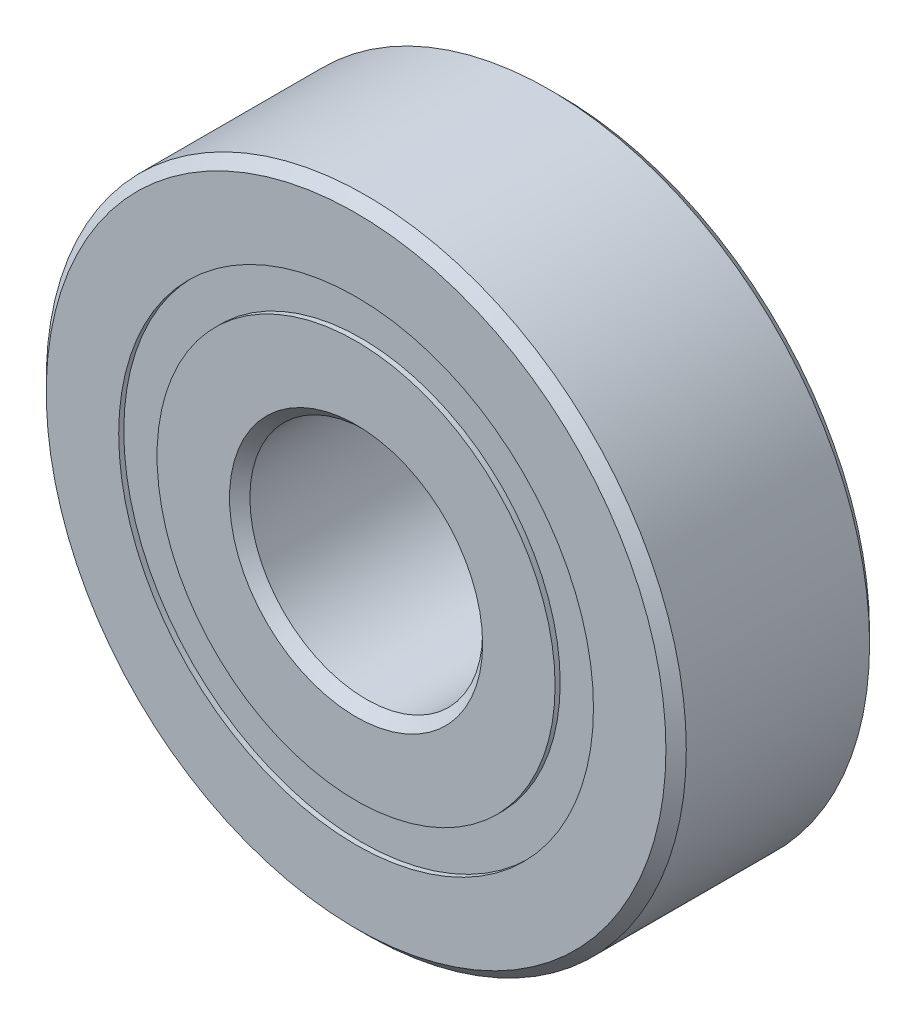
from build123d import *

# Parameters (mm, degrees)
SKETCH6_W = 1.635478413
SKETCH6_H = 1.318681318


with BuildPart() as part:
    # Sketch1 → Revolve1 (revolve)
    with BuildSketch(Plane(origin=(0, 0, 0), x_dir=(0, 0, -1), z_dir=(1, 0, 0))):
        with BuildLine():
            Line((3.15, 11), (-3.15, 11))
            Line((-3.15, 11), (-3.5, 10.65))
            Line((-3.5, 10.65), (-3.5, 8.159340659))
            Line((-3.5, 8.159340659), (-1.555555556, 8.159340659))
            ThreePointArc((-1.555555556, 8.159340659), (0, 9.189521587), (1.555555556, 8.159340659))
            Line((1.555555556, 8.159340659), (3.5, 8.159340659))
            Line((3.5, 8.159340659), (3.5, 10.65))
            Line((3.5, 10.65), (3.15, 11))
        make_face()
    revolve(axis=Axis((0, 0, 3.5), (0, 0, -1)))


with BuildPart() as body_2:
    # Sketch3 → Revolve3 (revolve)
    with BuildSketch(Plane(origin=(0, 0, 0), x_dir=(0, 0, -1), z_dir=(1, 0, 0))):
        with BuildLine():
            Line((-3.5, 6.840659341), (-1.555555556, 6.840659341))
            ThreePointArc((-1.555555556, 6.840659341), (0, 5.810478413), (1.555555556, 6.840659341))
            Line((1.555555556, 6.840659341), (3.5, 6.840659341))
            Line((3.5, 6.840659341), (3.5, 4.35))
            Line((3.5, 4.35), (3.15, 4))
            Line((3.15, 4), (-3.15, 4))
            Line((-3.15, 4), (-3.5, 4.35))
            Line((-3.5, 4.35), (-3.5, 6.840659341))
        make_face()
    revolve(axis=Axis((0, 0, 3.5), (0, 0, -1)))


with BuildPart() as body_3:
    # Sketch4 → Revolve4 (revolve)
    with BuildSketch(Plane(origin=(0, 0, 0), x_dir=(0, 0, -1), z_dir=(1, 0, 0))):
        with BuildLine():
            Line((-1.689521587, 7.5), (1.689521587, 7.5))
            ThreePointArc((1.689521587, 7.5), (0, 9.189521587), (-1.689521587, 7.5))
        make_face()
    revolve(axis=Axis((0, 7.5, 1.689521587), (0, 0, -1)))


with BuildPart() as body_4:
    # Sketch6 → Revolve5 (revolve)
    with BuildSketch(Plane(origin=(0, 0, 0), x_dir=(0, 0, -1), z_dir=(1, 0, 0))):
        with Locations((-2.507260794, 7.5)):
            Rectangle(SKETCH6_W, SKETCH6_H)
        with Locations((2.507260794, 7.5)):
            Rectangle(SKETCH6_W, SKETCH6_H)
    revolve(axis=Axis((0, 0, 3.5), (0, 0, -1)))


solid = Compound([part.part, body_2.part, body_3.part, body_4.part])
